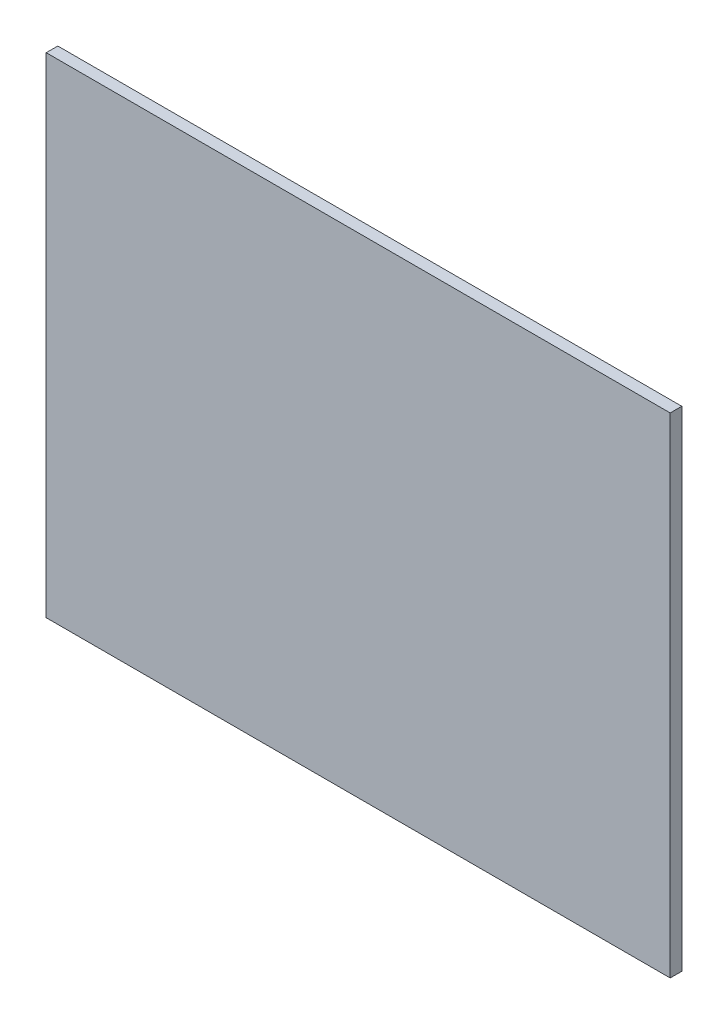
from build123d import *

# Parameters (mm, degrees)
EXTRUDE_START   = 0.6
SKETCH_1_W      = 43.1
SKETCH_1_H      = 33.8
EXTRUDE_1_DEPTH = 0.8


with BuildPart() as part:
    # Эскиз1 → Бобышка-Вытянуть1 (new body)
    with BuildSketch(Plane.XY.offset(EXTRUDE_START)):
        with Locations((-2.05, 0)):
            Rectangle(SKETCH_1_W, SKETCH_1_H)
    extrude(amount=EXTRUDE_1_DEPTH)


solid = part.part
